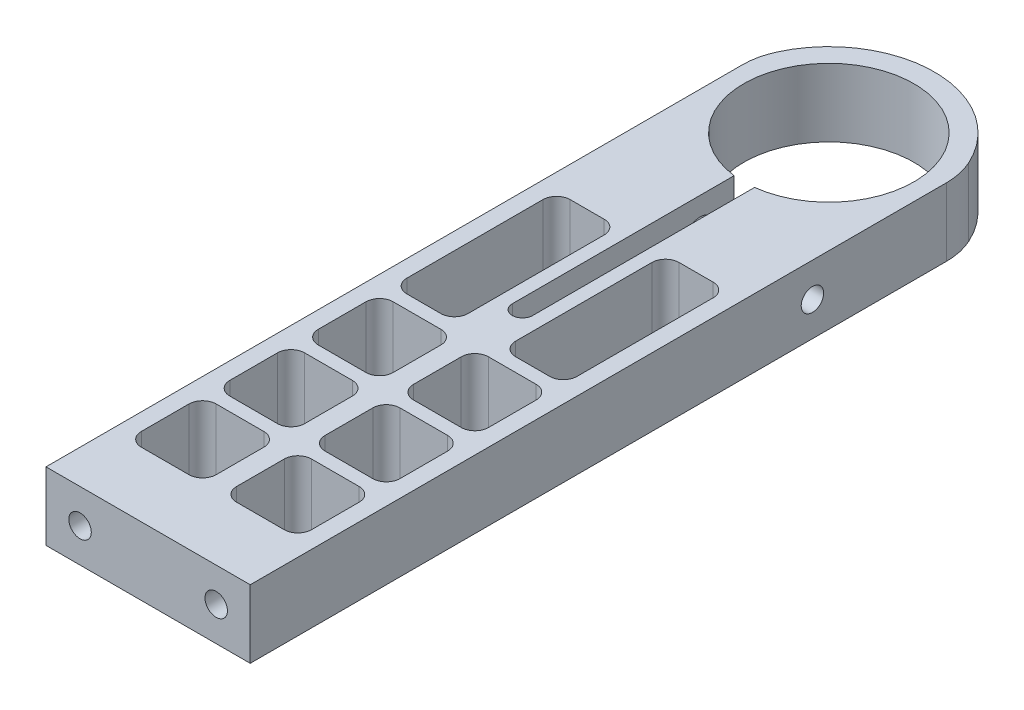
from build123d import *

# Parameters (mm, degrees)
SKETCH_1_R                  = 12.5
EXTRUDE_1_DEPTH             = 10
CUT_EXTRUDE_5_DEPTH         = 102.687019821
SKETCH_8_W                  = 1.65
SKETCH_8_H                  = 14
HOLE_START                  = -16
HOLE_WIZARD_M41_OUTLINE_R   = 4
HOLE_WIZARD_M41_DEPTH       = 5
HOLE_START_2                = -11
HOLE_WIZARD_M41_2_OUTLINE_R = 2.25
HOLE_WIZARD_M41_2_DEPTH     = 9.5
CUT_EXTRUDE_START           = -10
CUT_EXTRUDE_6_DEPTH         = 10
FILLET_1_R                  = 10
CUT_EXTRUDE_7_DEPTH         = 102.612007273
EXTRUDE_2_DEPTH             = 10
CUT_EXTRUDE_8_DEPTH         = 102.612007273


with BuildPart() as part:
    # Эскиз1 → Бобышка-Вытянуть1 (new body)
    with BuildSketch(Plane(origin=(0, 0, 0), x_dir=(1, 0, 0), z_dir=(0, 1, 0))):
        with BuildLine():
            Line((-15.5, 0), (-15.5, -100))
            Line((-15.5, -100), (15.5, -100))
            Line((15.5, -100), (15.5, 0))
            ThreePointArc((15.5, 0), (0, 15.5), (-15.5, 0))
        make_face()
        with Locations(Location((0, 0, 0), (0, 0, 270))):
            Circle(SKETCH_1_R, mode=Mode.SUBTRACT)
    extrude(amount=EXTRUDE_1_DEPTH)

    # Эскиз6 → Вырез-Вытянуть5 (cut, through all)
    with BuildSketch(Plane(origin=(0, 10, 0), x_dir=(1, 0, 0), z_dir=(0, 1, 0))):
        with BuildLine():
            Line((-1.5, -12.409673646), (-1.5, -26))
            ThreePointArc((-1.5, -26), (0, -27.5), (1.5, -26))
            Line((1.5, -26), (1.5, -12.409673646))
            ThreePointArc((1.5, -12.409673646), (0, -12.5), (-1.5, -12.409673646))
        make_face()
        with BuildLine():
            Line((-1.5, -42.5), (-1.5, -49.5))
            ThreePointArc((-1.5, -49.5), (-2.085786438, -50.914213562), (-3.5, -51.5))
            Line((-3.5, -51.5), (-10.5, -51.5))
            ThreePointArc((-10.5, -51.5), (-11.914213562, -50.914213562), (-12.5, -49.5))
            Line((-12.5, -49.5), (-12.5, -42.5))
            ThreePointArc((-12.5, -42.5), (-11.914213562, -41.085786438), (-10.5, -40.5))
            Line((-10.5, -40.5), (-3.5, -40.5))
            ThreePointArc((-3.5, -40.5), (-2.085786438, -41.085786438), (-1.5, -42.5))
        make_face()
        with BuildLine():
            Line((-1.5, -55.5), (-1.5, -62.5))
            ThreePointArc((-1.5, -62.5), (-2.085786438, -63.914213562), (-3.5, -64.5))
            Line((-3.5, -64.5), (-10.5, -64.5))
            ThreePointArc((-10.5, -64.5), (-11.914213562, -63.914213562), (-12.5, -62.5))
            Line((-12.5, -62.5), (-12.5, -55.5))
            ThreePointArc((-12.5, -55.5), (-11.914213562, -54.085786438), (-10.5, -53.5))
            Line((-10.5, -53.5), (-3.5, -53.5))
            ThreePointArc((-3.5, -53.5), (-2.085786438, -54.085786438), (-1.5, -55.5))
        make_face()
        with BuildLine():
            Line((-1.5, -68.5), (-1.5, -75.5))
            ThreePointArc((-1.5, -75.5), (-2.085786438, -76.914213562), (-3.5, -77.5))
            Line((-3.5, -77.5), (-10.5, -77.5))
            ThreePointArc((-10.5, -77.5), (-11.914213562, -76.914213562), (-12.5, -75.5))
            Line((-12.5, -75.5), (-12.5, -68.5))
            ThreePointArc((-12.5, -68.5), (-11.914213562, -67.085786438), (-10.5, -66.5))
            Line((-10.5, -66.5), (-3.5, -66.5))
            ThreePointArc((-3.5, -66.5), (-2.085786438, -67.085786438), (-1.5, -68.5))
        make_face()
        with BuildLine():
            Line((-1.5, -81.5), (-1.5, -88.5))
            ThreePointArc((-1.5, -88.5), (-2.085786438, -89.914213562), (-3.5, -90.5))
            Line((-3.5, -90.5), (-10.5, -90.5))
            ThreePointArc((-10.5, -90.5), (-11.914213562, -89.914213562), (-12.5, -88.5))
            Line((-12.5, -88.5), (-12.5, -81.5))
            ThreePointArc((-12.5, -81.5), (-11.914213562, -80.085786438), (-10.5, -79.5))
            Line((-10.5, -79.5), (-3.5, -79.5))
            ThreePointArc((-3.5, -79.5), (-2.085786438, -80.085786438), (-1.5, -81.5))
        make_face()
        with BuildLine():
            Line((1.5, -29.5), (1.5, -36.5))
            ThreePointArc((1.5, -36.5), (2.085786438, -37.914213562), (3.5, -38.5))
            Line((3.5, -38.5), (10.5, -38.5))
            ThreePointArc((10.5, -38.5), (11.914213562, -37.914213562), (12.5, -36.5))
            Line((12.5, -36.5), (12.5, -29.5))
            ThreePointArc((12.5, -29.5), (11.914213562, -28.085786438), (10.5, -27.5))
            Line((10.5, -27.5), (3.5, -27.5))
            ThreePointArc((3.5, -27.5), (2.085786438, -28.085786438), (1.5, -29.5))
        make_face()
        with BuildLine():
            Line((-12.5, -29.5), (-12.5, -36.5))
            ThreePointArc((-12.5, -36.5), (-11.914213562, -37.914213562), (-10.5, -38.5))
            Line((-10.5, -38.5), (-3.5, -38.5))
            ThreePointArc((-3.5, -38.5), (-2.085786438, -37.914213562), (-1.5, -36.5))
            Line((-1.5, -36.5), (-1.5, -29.5))
            ThreePointArc((-1.5, -29.5), (-2.085786438, -28.085786438), (-3.5, -27.5))
            Line((-3.5, -27.5), (-10.5, -27.5))
            ThreePointArc((-10.5, -27.5), (-11.914213562, -28.085786438), (-12.5, -29.5))
        make_face()
        with BuildLine():
            Line((10.5, -79.5), (3.5, -79.5))
            ThreePointArc((3.5, -79.5), (2.085786438, -80.085786438), (1.5, -81.5))
            Line((1.5, -81.5), (1.5, -88.5))
            ThreePointArc((1.5, -88.5), (2.085786438, -89.914213562), (3.5, -90.5))
            Line((3.5, -90.5), (10.5, -90.5))
            ThreePointArc((10.5, -90.5), (11.914213562, -89.914213562), (12.5, -88.5))
            Line((12.5, -88.5), (12.5, -81.5))
            ThreePointArc((12.5, -81.5), (11.914213562, -80.085786438), (10.5, -79.5))
        make_face()
        with BuildLine():
            Line((10.5, -66.5), (3.5, -66.5))
            ThreePointArc((3.5, -66.5), (2.085786438, -67.085786438), (1.5, -68.5))
            Line((1.5, -68.5), (1.5, -75.5))
            ThreePointArc((1.5, -75.5), (2.085786438, -76.914213562), (3.5, -77.5))
            Line((3.5, -77.5), (10.5, -77.5))
            ThreePointArc((10.5, -77.5), (11.914213562, -76.914213562), (12.5, -75.5))
            Line((12.5, -75.5), (12.5, -68.5))
            ThreePointArc((12.5, -68.5), (11.914213562, -67.085786438), (10.5, -66.5))
        make_face()
        with BuildLine():
            Line((10.5, -53.5), (3.5, -53.5))
            ThreePointArc((3.5, -53.5), (2.085786438, -54.085786438), (1.5, -55.5))
            Line((1.5, -55.5), (1.5, -62.5))
            ThreePointArc((1.5, -62.5), (2.085786438, -63.914213562), (3.5, -64.5))
            Line((3.5, -64.5), (10.5, -64.5))
            ThreePointArc((10.5, -64.5), (11.914213562, -63.914213562), (12.5, -62.5))
            Line((12.5, -62.5), (12.5, -55.5))
            ThreePointArc((12.5, -55.5), (11.914213562, -54.085786438), (10.5, -53.5))
        make_face()
        with BuildLine():
            Line((10.5, -40.5), (3.5, -40.5))
            ThreePointArc((3.5, -40.5), (2.085786438, -41.085786438), (1.5, -42.5))
            Line((1.5, -42.5), (1.5, -49.5))
            ThreePointArc((1.5, -49.5), (2.085786438, -50.914213562), (3.5, -51.5))
            Line((3.5, -51.5), (10.5, -51.5))
            ThreePointArc((10.5, -51.5), (11.914213562, -50.914213562), (12.5, -49.5))
            Line((12.5, -49.5), (12.5, -42.5))
            ThreePointArc((12.5, -42.5), (11.914213562, -41.085786438), (10.5, -40.5))
        make_face()
    extrude(amount=-CUT_EXTRUDE_5_DEPTH, mode=Mode.SUBTRACT)

    # Эскиз8 → Отверстие обработанное метчиком M4x0.71 (revolve, cut)
    with BuildSketch(Plane(origin=(1.5, 5, 17.409673646), x_dir=(0, 0, 1), z_dir=(0, 1, 0))):
        with Locations((0.825, 7)):
            Rectangle(SKETCH_8_W, SKETCH_8_H)
    revolve(axis=Axis((-4.85, 5, 17.409673646), (1, 0, 0)), mode=Mode.SUBTRACT)

    # Цековка для винта с внутренним шестигранником M41: read off the stored shape, not the designer's step
    # Цековка для винта с внутренним шестигранником M41 outline → Цековка для винта с внутренним шестигранником M41 (cut)
    with BuildSketch(Plane.YZ.offset(HOLE_START)):
        with Locations((5, 17.409673646)):
            Circle(HOLE_WIZARD_M41_OUTLINE_R)
    extrude(amount=HOLE_WIZARD_M41_DEPTH, mode=Mode.SUBTRACT)

    # Hole Wizard M41 2 outline → Hole Wizard M41 2 (cut)
    with BuildSketch(Plane.YZ.offset(HOLE_START_2)):
        with Locations((5, 17.409673646)):
            Circle(HOLE_WIZARD_M41_2_OUTLINE_R)
    extrude(amount=HOLE_WIZARD_M41_2_DEPTH, mode=Mode.SUBTRACT)

    # Эскиз12 → Вырез-Вытянуть6 (cut)
    with BuildSketch(Plane(origin=(0, 10, 0), x_dir=(1, 0, 0), z_dir=(0, 1, 0)).offset(CUT_EXTRUDE_START)):
        with BuildLine():
            Line((-15, 3.905124838), (-15, -100))
            Line((-15, -100), (-15.5, -100))
            Line((-15.5, -100), (-15.5, 0))
            ThreePointArc((-15.5, 0), (-15.374491862, 1.968501969), (-15, 3.905124838))
        make_face()
        with BuildLine():
            Line((15, -100), (15, 3.905124838))
            ThreePointArc((15, 3.905124838), (15.374491862, 1.968501969), (15.5, 0))
            Line((15.5, 0), (15.5, -100))
            Line((15.5, -100), (15, -100))
        make_face()
    extrude(amount=CUT_EXTRUDE_6_DEPTH, mode=Mode.SUBTRACT)

    # Скругление1
    fillet_1_edges = [part.edges().sort_by_distance(p)[0] for p in [
        (15, 5, -3.905124838),
        (-15, 5, -3.905124838),
    ]]
    fillet(fillet_1_edges, radius=FILLET_1_R)

    # Отверстие обработанное метчиком M4x0.72: read off the stored shape, not the designer's step
    # Отверстие обработанное метчиком M4x0.72: loft between two sections, ruled curve by curve
    m4x0_72_from = [
        Edge.make_three_point_arc((11.651711547, 5, 90.135107967), (10.001711547, 6.65, 90.135107967), (8.351711547, 5, 90.135107967)),
        Edge.make_three_point_arc((8.351711547, 5, 90.135107967), (10.001711547, 3.35, 90.135107967), (11.651711547, 5, 90.135107967)),
    ]
    m4x0_72_to = [
        Edge.make_three_point_arc((11.651711547, 5, 100), (10.001711547, 6.65, 100), (8.351711547, 5, 100)),
        Edge.make_three_point_arc((8.351711547, 5, 100), (10.001711547, 3.35, 100), (11.651711547, 5, 100)),
    ]
    m4x0_72 = Solid(Shell([*[Face.make_surface_from_curves(m4x0_72_from[k], m4x0_72_to[k]) for k in range(2)], Face(Wire(m4x0_72_from)), Face(Wire(m4x0_72_to))]))
    add(m4x0_72, mode=Mode.SUBTRACT)

    # M4x0.72 2: loft between two sections, ruled curve by curve
    m4x0_72_2_from = [
        Edge.make_three_point_arc((-8.348288453, 5, 90.137351426), (-9.998288453, 6.65, 90.137351426), (-11.648288453, 5, 90.137351426)),
        Edge.make_three_point_arc((-11.648288453, 5, 90.137351426), (-9.998288453, 3.35, 90.137351426), (-8.348288453, 5, 90.137351426)),
    ]
    m4x0_72_2_to = [
        Edge.make_three_point_arc((-8.348288453, 5, 100), (-9.998288453, 6.65, 100), (-11.648288453, 5, 100)),
        Edge.make_three_point_arc((-11.648288453, 5, 100), (-9.998288453, 3.35, 100), (-8.348288453, 5, 100)),
    ]
    m4x0_72_2 = Solid(Shell([*[Face.make_surface_from_curves(m4x0_72_2_from[k], m4x0_72_2_to[k]) for k in range(2)], Face(Wire(m4x0_72_2_from)), Face(Wire(m4x0_72_2_to))]))
    add(m4x0_72_2, mode=Mode.SUBTRACT)

    # Эскиз16 → Вырез-Вытянуть7 (cut, through all)
    with BuildSketch(Plane(origin=(0, 10, 0), x_dir=(1, 0, 0), z_dir=(0, 1, 0))):
        with BuildLine():
            Line((1.5, -26), (1.5, -45))
            ThreePointArc((1.5, -45), (0, -46.5), (-1.5, -45))
            Line((-1.5, -45), (-1.5, -26))
            ThreePointArc((-1.5, -26), (0, -24.5), (1.5, -26))
        make_face()
    extrude(amount=-CUT_EXTRUDE_7_DEPTH, mode=Mode.SUBTRACT)

    # Эскиз17 → Бобышка-Вытянуть2 (add, through all)
    with BuildSketch(Plane(origin=(0, 10, 0), x_dir=(1, 0, 0), z_dir=(0, 1, 0))):
        with BuildLine():
            Line((-1.5, -29.5), (-1.5, -36.5))
            ThreePointArc((-1.5, -36.5), (-2.085786438, -37.914213562), (-3.5, -38.5))
            Line((-3.5, -38.5), (-5.5, -38.5))
            ThreePointArc((-5.5, -38.5), (-4.085786438, -37.914213562), (-3.5, -36.5))
            Line((-3.5, -36.5), (-3.5, -29.5))
            ThreePointArc((-3.5, -29.5), (-4.085786438, -28.085786438), (-5.5, -27.5))
            Line((-5.5, -27.5), (-3.5, -27.5))
            ThreePointArc((-3.5, -27.5), (-2.085786438, -28.085786438), (-1.5, -29.5))
        make_face()
        with BuildLine():
            Line((-1.5, -42.5), (-1.5, -49.5))
            ThreePointArc((-1.5, -49.5), (-2.085786438, -50.914213562), (-3.5, -51.5))
            Line((-3.5, -51.5), (-5.5, -51.5))
            ThreePointArc((-5.5, -51.5), (-4.085786438, -50.914213562), (-3.5, -49.5))
            Line((-3.5, -49.5), (-3.5, -42.5))
            ThreePointArc((-3.5, -42.5), (-4.085786438, -41.085786438), (-5.5, -40.5))
            Line((-5.5, -40.5), (-3.5, -40.5))
            ThreePointArc((-3.5, -40.5), (-2.085786438, -41.085786438), (-1.5, -42.5))
        make_face()
        with BuildLine():
            Line((5.5, -51.5), (3.5, -51.5))
            ThreePointArc((3.5, -51.5), (2.085786438, -50.914213562), (1.5, -49.5))
            Line((1.5, -49.5), (1.5, -42.5))
            ThreePointArc((1.5, -42.5), (2.085786438, -41.085786438), (3.5, -40.5))
            Line((3.5, -40.5), (5.5, -40.5))
            ThreePointArc((5.5, -40.5), (4.085786438, -41.085786438), (3.5, -42.5))
            Line((3.5, -42.5), (3.5, -49.5))
            ThreePointArc((3.5, -49.5), (4.085786438, -50.914213562), (5.5, -51.5))
        make_face()
        with BuildLine():
            Line((5.5, -38.5), (3.5, -38.5))
            ThreePointArc((3.5, -38.5), (2.085786438, -37.914213562), (1.5, -36.5))
            Line((1.5, -36.5), (1.5, -29.5))
            ThreePointArc((1.5, -29.5), (2.085786438, -28.085786438), (3.5, -27.5))
            Line((3.5, -27.5), (5.5, -27.5))
            ThreePointArc((5.5, -27.5), (4.085786438, -28.085786438), (3.5, -29.5))
            Line((3.5, -29.5), (3.5, -36.5))
            ThreePointArc((3.5, -36.5), (4.085786438, -37.914213562), (5.5, -38.5))
        make_face()
    extrude(amount=-EXTRUDE_2_DEPTH)

    # Эскиз18 → Вырез-Вытянуть8 (cut, through all)
    with BuildSketch(Plane(origin=(0, 10, 0), x_dir=(1, 0, 0), z_dir=(0, 1, 0))):
        with BuildLine():
            Line((-5.5, -27.5), (-10.5, -27.5))
            ThreePointArc((-10.5, -27.5), (-11.914213562, -28.085786438), (-12.5, -29.5))
            Line((-12.5, -29.5), (-12.5, -42.5))
            Line((-12.5, -42.5), (-12.5, -49.5))
            ThreePointArc((-12.5, -49.5), (-11.914213562, -50.914213562), (-10.5, -51.5))
            Line((-10.5, -51.5), (-5.5, -51.5))
            ThreePointArc((-5.5, -51.5), (-4.085786438, -50.914213562), (-3.5, -49.5))
            Line((-3.5, -49.5), (-3.5, -42.5))
            Line((-3.5, -42.5), (-3.5, -29.5))
            ThreePointArc((-3.5, -29.5), (-4.085786438, -28.085786438), (-5.5, -27.5))
        make_face()
        with BuildLine():
            Line((3.5, -29.5), (3.5, -42.5))
            Line((3.5, -42.5), (3.5, -49.5))
            ThreePointArc((3.5, -49.5), (4.085786438, -50.914213562), (5.5, -51.5))
            Line((5.5, -51.5), (10.5, -51.5))
            ThreePointArc((10.5, -51.5), (11.914213562, -50.914213562), (12.5, -49.5))
            Line((12.5, -49.5), (12.5, -42.5))
            Line((12.5, -42.5), (12.5, -29.5))
            ThreePointArc((12.5, -29.5), (11.914213562, -28.085786438), (10.5, -27.5))
            Line((10.5, -27.5), (5.5, -27.5))
            ThreePointArc((5.5, -27.5), (4.085786438, -28.085786438), (3.5, -29.5))
        make_face()
    extrude(amount=-CUT_EXTRUDE_8_DEPTH, mode=Mode.SUBTRACT)


solid = part.part
